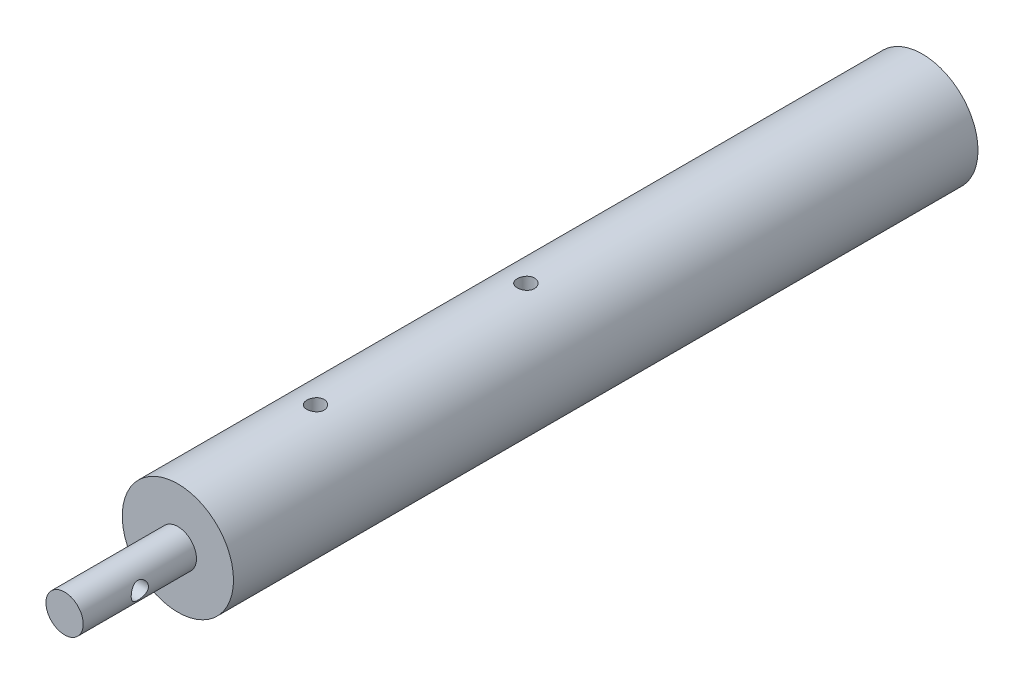
from build123d import *

# Parameters (mm, degrees)
SKETCH1_R             = 8.73125
BOSS_EXTRUDE1_DEPTH   = 116.84
SKETCH2_R             = 2.921
BOSS_EXTRUDE2_DEPTH   = 17.78
F_6_32_TAPPED_HOLE1_D = 2.7051
F_6_32_TAPPED_HOLE2_D = 2.7051


with BuildPart() as part:
    # Sketch1 → Boss-Extrude1 (new body)
    with BuildSketch(Plane.XY):
        Circle(SKETCH1_R)
    extrude(amount=BOSS_EXTRUDE1_DEPTH)

    # Sketch2 → Boss-Extrude2 (add)
    with BuildSketch(Plane.XY.offset(116.84)):
        Circle(SKETCH2_R)
    extrude(amount=BOSS_EXTRUDE2_DEPTH)

    # #6-32 Tapped Hole1 (through all)
    with Locations(Plane(origin=(0, 8.73125, 0), x_dir=(1, 0, 0), z_dir=(0, 1, 0))):
        with Locations((0, -62.23), (0, -95.25)):
            Hole(F_6_32_TAPPED_HOLE1_D / 2)

    # #6-32 Tapped Hole2 (through all)
    with Locations(Plane(origin=(2.921, 0, 0), x_dir=(0, 0, -1), z_dir=(1, 0, 0))):
        with Locations((-125.73, 0)):
            Hole(F_6_32_TAPPED_HOLE2_D / 2)


solid = part.part
